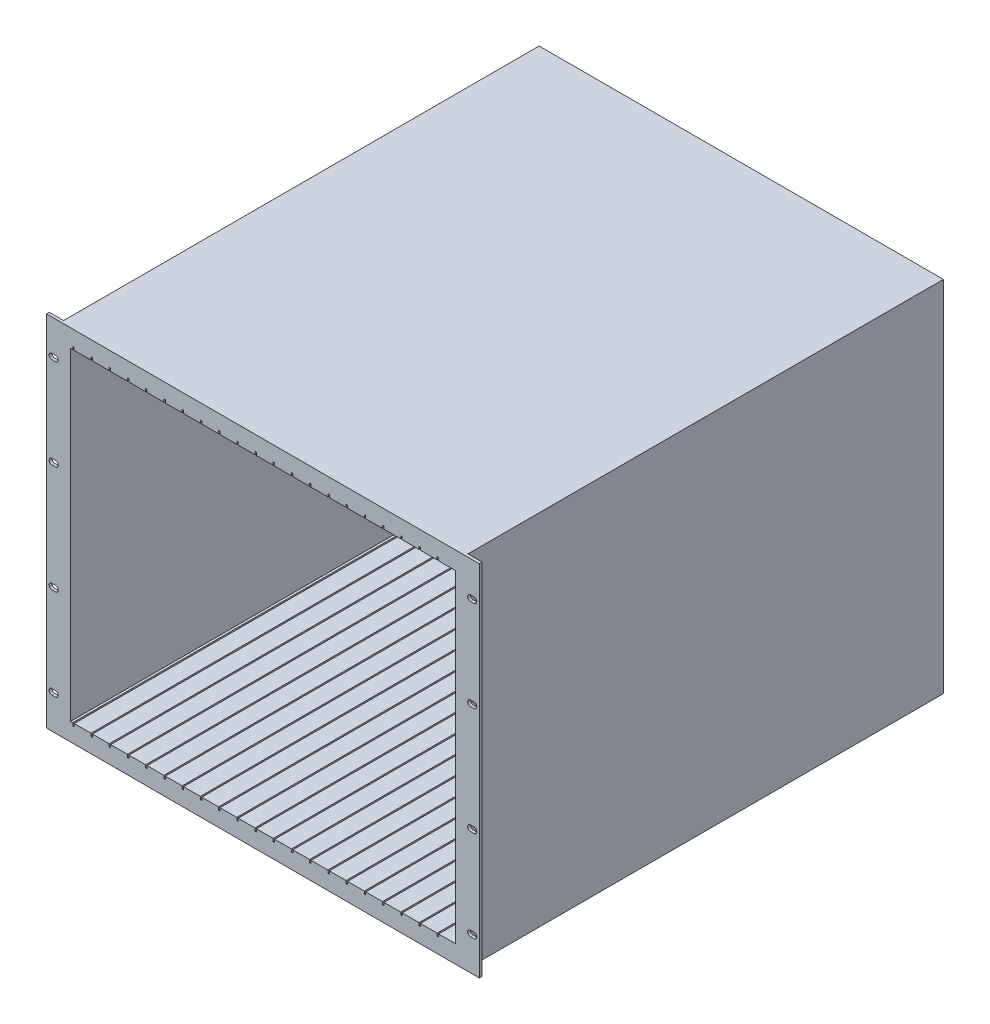
from build123d import *

# Parameters (mm, degrees)
SKETCH1_W                           = 482.6
SKETCH1_H                           = 533.4
BOSS_EXTRUDE1_DEPTH                 = 19.8374
SKETCH3_W                           = 26.67
SKETCH3_H                           = 533.4
BOSS_EXTRUDE2_DEPTH                 = 180.1876
SKETCH2_W                           = 1.5875
SKETCH2_H                           = 533.4
CUT_EXTRUDE1_DEPTH                  = 3.175
SKETCH4_W                           = 15.875
SKETCH4_H                           = 530.225
CUT_EXTRUDE2_DEPTH                  = 824.07856399
TAP_START                           = -3.175
TAP_DRILL_SLOT_FOR_10_24_TAP1_DEPTH = 3.175
TAP_DRILL_SLOT_FOR_10_24_TAP2_DEPTH = 3.175


# Read off the part's stored shape, not the designer's step: Tap Drill Slot for #10-24 Tap1, Tap Drill Slot for #10-24 Tap2
with BuildPart() as part:
    # Sketch1 → Boss-Extrude1 (new body)
    with BuildSketch(Plane(origin=(0, 0, 0), x_dir=(1, 0, 0), z_dir=(0, 1, 0))):
        with Locations((241.3, 266.7)):
            Rectangle(SKETCH1_W, SKETCH1_H)
    extrude(amount=BOSS_EXTRUDE1_DEPTH)

    # Sketch3 → Boss-Extrude2 (add)
    with BuildSketch(Plane(origin=(0, 19.8374, 0), x_dir=(1, 0, 0), z_dir=(0, 1, 0))):
        with Locations((13.335, 266.7)):
            Rectangle(SKETCH3_W, SKETCH3_H)
        with Locations((469.265, 266.7)):
            Rectangle(SKETCH3_W, SKETCH3_H)
    extrude(amount=BOSS_EXTRUDE2_DEPTH)

    # Sketch2 → Cut-Extrude1 (cut)
    with BuildSketch(Plane(origin=(0, 19.8374, 0), x_dir=(1, 0, 0), z_dir=(0, 1, 0))):
        with Locations((30.00375, 266.7)):
            Rectangle(SKETCH2_W, SKETCH2_H)
        with Locations((50.32375, 266.7)):
            Rectangle(SKETCH2_W, SKETCH2_H)
        with Locations((70.64375, 266.7)):
            Rectangle(SKETCH2_W, SKETCH2_H)
        with Locations((90.96375, 266.7)):
            Rectangle(SKETCH2_W, SKETCH2_H)
        with Locations((111.28375, 266.7)):
            Rectangle(SKETCH2_W, SKETCH2_H)
        with Locations((131.60375, 266.7)):
            Rectangle(SKETCH2_W, SKETCH2_H)
        with Locations((151.92375, 266.7)):
            Rectangle(SKETCH2_W, SKETCH2_H)
        with Locations((172.24375, 266.7)):
            Rectangle(SKETCH2_W, SKETCH2_H)
        with Locations((192.56375, 266.7)):
            Rectangle(SKETCH2_W, SKETCH2_H)
        with Locations((212.88375, 266.7)):
            Rectangle(SKETCH2_W, SKETCH2_H)
        with Locations((233.20375, 266.7)):
            Rectangle(SKETCH2_W, SKETCH2_H)
        with Locations((253.52375, 266.7)):
            Rectangle(SKETCH2_W, SKETCH2_H)
        with Locations((273.84375, 266.7)):
            Rectangle(SKETCH2_W, SKETCH2_H)
        with Locations((294.16375, 266.7)):
            Rectangle(SKETCH2_W, SKETCH2_H)
        with Locations((314.48375, 266.7)):
            Rectangle(SKETCH2_W, SKETCH2_H)
        with Locations((334.80375, 266.7)):
            Rectangle(SKETCH2_W, SKETCH2_H)
        with Locations((355.12375, 266.7)):
            Rectangle(SKETCH2_W, SKETCH2_H)
        with Locations((375.44375, 266.7)):
            Rectangle(SKETCH2_W, SKETCH2_H)
        with Locations((395.76375, 266.7)):
            Rectangle(SKETCH2_W, SKETCH2_H)
        with Locations((416.08375, 266.7)):
            Rectangle(SKETCH2_W, SKETCH2_H)
        with Locations((436.40375, 266.7)):
            Rectangle(SKETCH2_W, SKETCH2_H)
    extrude(amount=-CUT_EXTRUDE1_DEPTH, mode=Mode.SUBTRACT)

    # Mirror1: part across plane


with BuildPart() as part_1:
    add(part.part)
    add(part.part.mirror(Plane.ZX.offset(200.025)))

    # Sketch4 → Cut-Extrude2 (cut, through all)
    with BuildSketch(Plane(origin=(0, 400.05, 0), x_dir=(1, 0, 0), z_dir=(0, 1, 0))):
        with Locations((7.9375, 268.2875)):
            Rectangle(SKETCH4_W, SKETCH4_H)
        with Locations((474.6625, 268.2875)):
            Rectangle(SKETCH4_W, SKETCH4_H)
    extrude(amount=-CUT_EXTRUDE2_DEPTH, mode=Mode.SUBTRACT)

    # Tap Drill Slot for #10-24 Tap1 outline → Tap Drill Slot for #10-24 Tap1 (cut)
    with BuildSketch(Plane.XY.offset(TAP_START)):
        with BuildLine():
            Line((472.7575, 358.775), (476.5675, 358.775))
            ThreePointArc((476.5675, 358.775), (479.7425, 361.95), (476.5675, 365.125))
            Line((476.5675, 365.125), (472.7575, 365.125))
            ThreePointArc((472.7575, 365.125), (469.5825, 361.95), (472.7575, 358.775))
        make_face()
        with BuildLine():
            ThreePointArc((9.8425, 358.775), (13.0175, 361.95), (9.8425, 365.125))
            Line((9.8425, 365.125), (6.0325, 365.125))
            ThreePointArc((6.0325, 365.125), (2.8575, 361.95), (6.0325, 358.775))
            Line((6.0325, 358.775), (9.8425, 358.775))
        make_face()
        with BuildLine():
            Line((472.7575, 257.175), (476.5675, 257.175))
            ThreePointArc((476.5675, 257.175), (479.7425, 260.35), (476.5675, 263.525))
            Line((476.5675, 263.525), (472.7575, 263.525))
            ThreePointArc((472.7575, 263.525), (469.5825, 260.35), (472.7575, 257.175))
        make_face()
        with BuildLine():
            ThreePointArc((9.8425, 257.175), (13.0175, 260.35), (9.8425, 263.525))
            Line((9.8425, 263.525), (6.0325, 263.525))
            ThreePointArc((6.0325, 263.525), (2.8575, 260.35), (6.0325, 257.175))
            Line((6.0325, 257.175), (9.8425, 257.175))
        make_face()
        with BuildLine():
            Line((472.7575, 136.525), (476.5675, 136.525))
            ThreePointArc((476.5675, 136.525), (479.7425, 139.7), (476.5675, 142.875))
            Line((476.5675, 142.875), (472.7575, 142.875))
            ThreePointArc((472.7575, 142.875), (469.5825, 139.7), (472.7575, 136.525))
        make_face()
        with BuildLine():
            ThreePointArc((9.8425, 136.525), (13.0175, 139.7), (9.8425, 142.875))
            Line((9.8425, 142.875), (6.0325, 142.875))
            ThreePointArc((6.0325, 142.875), (2.8575, 139.7), (6.0325, 136.525))
            Line((6.0325, 136.525), (9.8425, 136.525))
        make_face()
        with BuildLine():
            Line((472.7575, 34.925), (476.5675, 34.925))
            ThreePointArc((476.5675, 34.925), (479.7425, 38.1), (476.5675, 41.275))
            Line((476.5675, 41.275), (472.7575, 41.275))
            ThreePointArc((472.7575, 41.275), (469.5825, 38.1), (472.7575, 34.925))
        make_face()
        with BuildLine():
            ThreePointArc((9.8425, 34.925), (13.0175, 38.1), (9.8425, 41.275))
            Line((9.8425, 41.275), (6.0325, 41.275))
            ThreePointArc((6.0325, 41.275), (2.8575, 38.1), (6.0325, 34.925))
            Line((6.0325, 34.925), (9.8425, 34.925))
        make_face()
    extrude(amount=TAP_DRILL_SLOT_FOR_10_24_TAP1_DEPTH, mode=Mode.SUBTRACT)

    # Tap Drill Slot for #10-24 Tap2 outline → Tap Drill Slot for #10-24 Tap2 (cut)
    with BuildSketch(Plane.XY.offset(TAP_START)):
        with BuildLine():
            ThreePointArc((472.754499776, 358.775001418), (469.5825, 361.949999999), (472.754499775, 365.124998582))
            ThreePointArc((472.754499775, 365.124998582), (469.579499774, 361.949999999), (472.754499776, 358.775001418))
        make_face()
    extrude(amount=TAP_DRILL_SLOT_FOR_10_24_TAP2_DEPTH, mode=Mode.SUBTRACT)


solid = part_1.part
